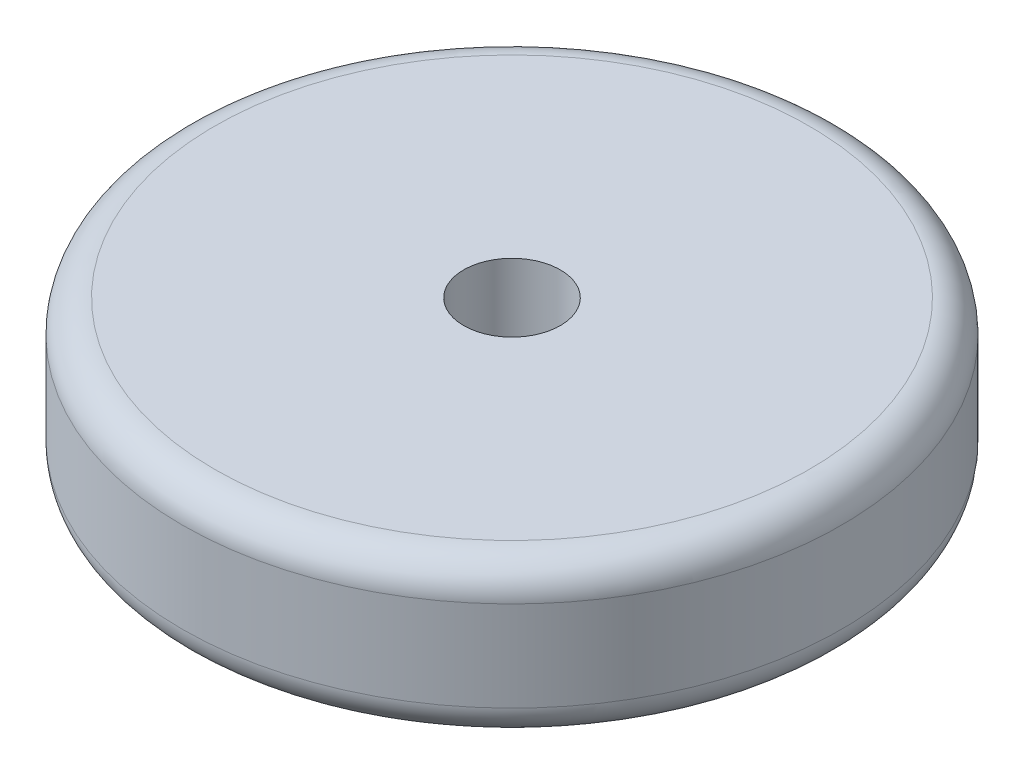
from build123d import *

# Parameters (mm, degrees)
SKETCH1_R           = 64.9605
BOSS_EXTRUDE1_DEPTH = 15.24
SKETCH2_R           = 9.525
CUT_EXTRUDE1_DEPTH  = 30.48
FILLET1_R           = 6.35


with BuildPart() as part:
    # Sketch1 → Boss-Extrude1 (new, symmetric)
    with BuildSketch(Plane(origin=(0, 0, 0), x_dir=(1, 0, 0), z_dir=(0, 1, 0))):
        Circle(SKETCH1_R)
    extrude(amount=BOSS_EXTRUDE1_DEPTH, both=True)

    # Sketch2 → Cut-Extrude1 (cut)
    with BuildSketch(Plane(origin=(0, 15.24, 0), x_dir=(1, 0, 0), z_dir=(0, 1, 0))):
        Circle(SKETCH2_R)
    extrude(amount=-CUT_EXTRUDE1_DEPTH, mode=Mode.SUBTRACT)

    # Fillet1
    fillet1_edges = [part.edges().sort_by_distance(p)[0] for p in [
        (-64.9605, -15.24, 0),
        (-64.9605, 15.24, 0),
    ]]
    fillet(fillet1_edges, radius=FILLET1_R)


solid = part.part
